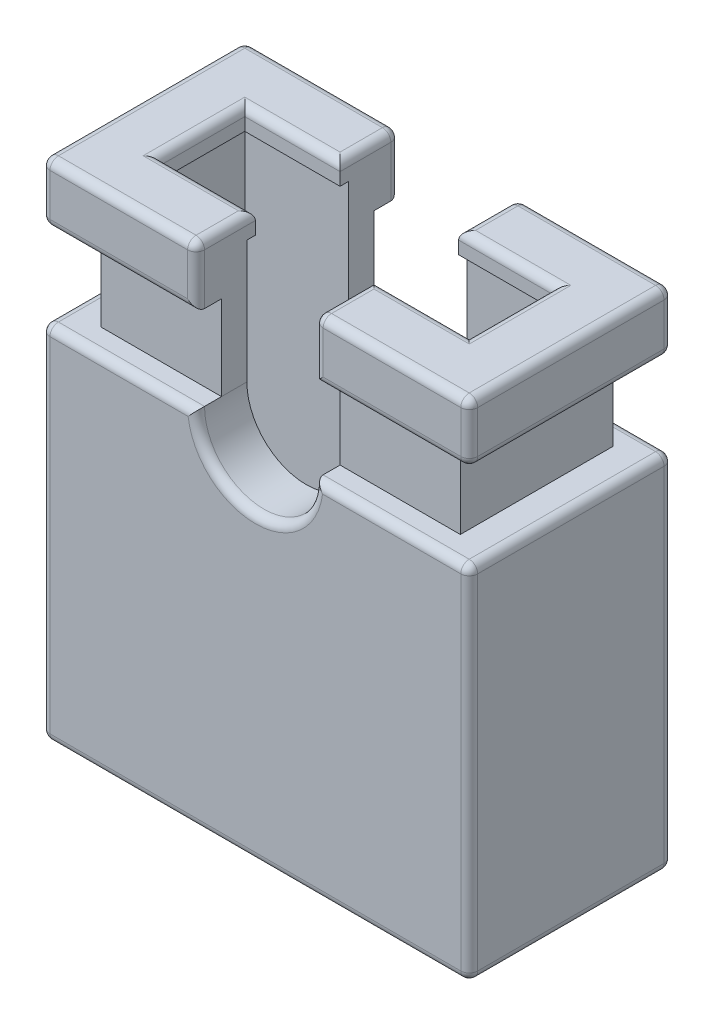
from build123d import *

# Parameters (mm, degrees)
SKETCH1_W          = 5.05
SKETCH1_H          = 5.96
MAIN_BODY_DEPTH    = 1.2
SKETCH2_W          = 5.05
SKETCH2_H          = 2.4
SKETCH2_W_2        = 4.24
SKETCH2_H_2        = 1.8
CUT_EXTRUDE1_DEPTH = 1
CUT_EXTRUDE2_START = -2.4
CUT_EXTRUDE2_DEPTH = 2.4
SKETCH4_W          = 3.85
SKETCH4_H          = 1.2
CUT_EXTRUDE3_DEPTH = 5.71
CUT_EXTRUDE4_START = -0.25
SKETCH5_W          = 3.65
SKETCH5_H          = 1
CUT_EXTRUDE4_DEPTH = 0.25
FILLET1_R          = 0.1
FILLET2_R          = 0.1


# Read off the part's stored shape, not the designer's step: Cut-Extrude2
with BuildPart() as part:
    # Sketch1 → Main Body (new, symmetric)
    with BuildSketch(Plane.XY):
        Rectangle(SKETCH1_W, SKETCH1_H)
    extrude(amount=MAIN_BODY_DEPTH, both=True)

    # Sketch2 → Cut-Extrude1 (cut)
    with BuildSketch(Plane(origin=(0, 2.28, 0), x_dir=(1, 0, 0), z_dir=(0, 1, 0))):
        Rectangle(SKETCH2_W, SKETCH2_H)
        Rectangle(SKETCH2_W_2, SKETCH2_H_2, mode=Mode.SUBTRACT)
    extrude(amount=-CUT_EXTRUDE1_DEPTH, mode=Mode.SUBTRACT)

    # Cut-Extrude2 outline → Cut-Extrude2 (cut)
    with BuildSketch(Plane.XY.offset(1.2).offset(CUT_EXTRUDE2_START)):
        with BuildLine():
            ThreePointArc((-0.7, 1.28), (0, 0.58), (0.7, 1.28))
            Line((0.7, 1.28), (0.7, 2.98))
            Line((0.7, 2.98), (-0.7, 2.98))
            Line((-0.7, 2.98), (-0.7, 1.28))
        make_face()
    extrude(amount=CUT_EXTRUDE2_DEPTH, mode=Mode.SUBTRACT)

    # Sketch4 → Cut-Extrude3 (cut)
    with BuildSketch(Plane.XZ.offset(2.98)):
        Rectangle(SKETCH4_W, SKETCH4_H)
    extrude(amount=-CUT_EXTRUDE3_DEPTH, mode=Mode.SUBTRACT)

    # Sketch5 → Cut-Extrude4 (cut)
    with BuildSketch(Plane(origin=(0, 2.98, 0), x_dir=(1, 0, 0), z_dir=(0, 1, 0)).offset(CUT_EXTRUDE4_START)):
        Rectangle(SKETCH5_W, SKETCH5_H)
    extrude(amount=CUT_EXTRUDE4_DEPTH, mode=Mode.SUBTRACT)

    # Fillet1
    fillet1_edges = [part.edges().sort_by_distance(p)[0] for p in [
        (-1.2625, 2.98, 0.5),
        (-0.7, 2.98, 0.85),
        (-1.6125, 2.98, 1.2),
        (-2.525, 2.98, 0),
        (-1.6125, 2.98, -1.2),
        (-0.7, 2.98, -0.85),
        (-1.2625, 2.98, -0.5),
        (-1.825, 2.98, 0),
        (1.2625, 2.98, -0.5),
        (0.7, 2.98, -0.85),
        (1.6125, 2.98, -1.2),
        (2.525, 2.98, 0),
        (1.6125, 2.98, 1.2),
        (0.7, 2.98, 0.85),
        (1.2625, 2.98, 0.5),
        (1.825, 2.98, 0),
        (2.525, -2.98, 0),
        (2.525, 1.28, 0),
        (-1.6125, 1.28, -1.2),
        (0, -2.98, -1.2),
        (2.525, -0.85, -1.2),
        (1.6125, 1.28, -1.2),
        (0, 0.58, -1.2),
        (1.6125, 1.28, 1.2),
        (2.525, -0.85, 1.2),
        (0, -2.98, 1.2),
        (-1.6125, 1.28, 1.2),
        (0, 0.58, 1.2),
        (-2.525, -0.85, 1.2),
        (-2.525, -2.98, 0),
        (-2.525, -0.85, -1.2),
        (-2.525, 1.28, 0),
    ]]
    fillet(fillet1_edges, radius=FILLET1_R)

    # Fillet2
    # the kernel refuses this fillet: 0.1 mm, written as the material it takes off along each edge
    with BuildSketch(Plane(origin=(-0.8, 2.88, -1.1), x_dir=(0, 0, -1), z_dir=(1, 0, 0))) as fillet2_piece_1_section:
        Polygon((0, 0), (FILLET2_R, 0), (FILLET2_R, FILLET2_R), (0, FILLET2_R), align=None)
    fillet2_piece_1 = extrude(amount=FILLET2_R, mode=Mode.PRIVATE)
    fillet2_piece_1 = fillet2_piece_1 - Plane(origin=(-0.8, 2.88, -1.1), x_dir=(0, -0.7071067811865475, 0.7071067811865475), z_dir=(1, 0, 0)) * Sphere(FILLET2_R, mode=Mode.PRIVATE)
    add(fillet2_piece_1, mode=Mode.SUBTRACT)
    with BuildSketch(Plane(origin=(-2.425, 2.88, -1.1), x_dir=(0, 0, -1), z_dir=(-1, 0, 0))) as fillet2_piece_2_section:
        Polygon((0, 0), (FILLET2_R, 0), (FILLET2_R, -FILLET2_R), (0, -FILLET2_R), align=None)
    fillet2_piece_2 = extrude(amount=FILLET2_R, mode=Mode.PRIVATE)
    fillet2_piece_2 = fillet2_piece_2 - Plane(origin=(-2.425, 2.88, -1.1), x_dir=(0, -0.7071067811865475, 0.7071067811865475), z_dir=(-1, 0, 0)) * Sphere(FILLET2_R, mode=Mode.PRIVATE)
    add(fillet2_piece_2, mode=Mode.SUBTRACT)
    with BuildSketch(Plane(origin=(-2.425, 2.88, 1.1), x_dir=(-1, 0, 0), z_dir=(0, 0, 1))) as fillet2_piece_3_section:
        Polygon((0, 0), (FILLET2_R, 0), (FILLET2_R, -FILLET2_R), (0, -FILLET2_R), align=None)
    fillet2_piece_3 = extrude(amount=FILLET2_R, mode=Mode.PRIVATE)
    fillet2_piece_3 = fillet2_piece_3 - Plane(origin=(-2.425, 2.88, 1.1), x_dir=(0.7071067811865476, -0.7071067811865475, 0), z_dir=(0, 0, 1)) * Sphere(FILLET2_R, mode=Mode.PRIVATE)
    add(fillet2_piece_3, mode=Mode.SUBTRACT)
    with BuildSketch(Plane(origin=(-0.8, 2.88, 1.1), x_dir=(0, 0, 1), z_dir=(1, 0, 0))) as fillet2_piece_4_section:
        Polygon((0, 0), (FILLET2_R, 0), (FILLET2_R, -FILLET2_R), (0, -FILLET2_R), align=None)
    fillet2_piece_4 = extrude(amount=FILLET2_R, mode=Mode.PRIVATE)
    fillet2_piece_4 = fillet2_piece_4 - Plane(origin=(-0.8, 2.88, 1.1), x_dir=(0, -0.7071067811865475, -0.7071067811865475), z_dir=(1, 0, 0)) * Sphere(FILLET2_R, mode=Mode.PRIVATE)
    add(fillet2_piece_4, mode=Mode.SUBTRACT)
    with BuildSketch(Plane(origin=(0.8, 2.88, 1.1), x_dir=(0, 0, 1), z_dir=(-1, 0, 0))) as fillet2_piece_5_section:
        Polygon((0, 0), (FILLET2_R, 0), (FILLET2_R, FILLET2_R), (0, FILLET2_R), align=None)
    fillet2_piece_5 = extrude(amount=FILLET2_R, mode=Mode.PRIVATE)
    fillet2_piece_5 = fillet2_piece_5 - Plane(origin=(0.8, 2.88, 1.1), x_dir=(0, -0.7071067811865475, -0.7071067811865475), z_dir=(-1, 0, 0)) * Sphere(FILLET2_R, mode=Mode.PRIVATE)
    add(fillet2_piece_5, mode=Mode.SUBTRACT)
    with BuildSketch(Plane(origin=(2.425, 2.88, 1.1), x_dir=(1, 0, 0), z_dir=(0, 0, 1))) as fillet2_piece_6_section:
        Polygon((0, 0), (FILLET2_R, 0), (FILLET2_R, FILLET2_R), (0, FILLET2_R), align=None)
    fillet2_piece_6 = extrude(amount=FILLET2_R, mode=Mode.PRIVATE)
    fillet2_piece_6 = fillet2_piece_6 - Plane(origin=(2.425, 2.88, 1.1), x_dir=(-0.7071067811865475, -0.7071067811865477, 0), z_dir=(0, 0, 1)) * Sphere(FILLET2_R, mode=Mode.PRIVATE)
    add(fillet2_piece_6, mode=Mode.SUBTRACT)
    with BuildSketch(Plane(origin=(2.425, 2.88, -1.1), x_dir=(1, 0, 0), z_dir=(0, 0, -1))) as fillet2_piece_7_section:
        Polygon((0, 0), (FILLET2_R, 0), (FILLET2_R, -FILLET2_R), (0, -FILLET2_R), align=None)
    fillet2_piece_7 = extrude(amount=FILLET2_R, mode=Mode.PRIVATE)
    fillet2_piece_7 = fillet2_piece_7 - Plane(origin=(2.425, 2.88, -1.1), x_dir=(-0.7071067811865475, -0.7071067811865477, 0), z_dir=(0, 0, -1)) * Sphere(FILLET2_R, mode=Mode.PRIVATE)
    add(fillet2_piece_7, mode=Mode.SUBTRACT)
    with BuildSketch(Plane(origin=(0.8, 2.88, -1.1), x_dir=(0, 0, -1), z_dir=(-1, 0, 0))) as fillet2_piece_8_section:
        Polygon((0, 0), (FILLET2_R, 0), (FILLET2_R, -FILLET2_R), (0, -FILLET2_R), align=None)
    fillet2_piece_8 = extrude(amount=FILLET2_R, mode=Mode.PRIVATE)
    fillet2_piece_8 = fillet2_piece_8 - Plane(origin=(0.8, 2.88, -1.1), x_dir=(0, -0.7071067811865475, 0.7071067811865475), z_dir=(-1, 0, 0)) * Sphere(FILLET2_R, mode=Mode.PRIVATE)
    add(fillet2_piece_8, mode=Mode.SUBTRACT)
    with BuildSketch(Plane(origin=(-2.425, 2.38, 1.1), x_dir=(0, 0, 1), z_dir=(0, -1, 0))) as fillet2_piece_9_section:
        Polygon((0, 0), (FILLET2_R, 0), (FILLET2_R, FILLET2_R), (0, FILLET2_R), align=None)
    fillet2_piece_9 = extrude(amount=FILLET2_R, mode=Mode.PRIVATE)
    fillet2_piece_9 = fillet2_piece_9 - Plane(origin=(-2.425, 2.38, 1.1), x_dir=(0.7071067811865475, 0, -0.7071067811865475), z_dir=(0, -1, 0)) * Sphere(FILLET2_R, mode=Mode.PRIVATE)
    add(fillet2_piece_9, mode=Mode.SUBTRACT)
    with BuildSketch(Plane(origin=(-2.425, 2.38, -1.1), x_dir=(0, -1, 0), z_dir=(0, 0, -1))) as fillet2_piece_10_section:
        Polygon((0, 0), (FILLET2_R, 0), (FILLET2_R, FILLET2_R), (0, FILLET2_R), align=None)
    fillet2_piece_10 = extrude(amount=FILLET2_R, mode=Mode.PRIVATE)
    fillet2_piece_10 = fillet2_piece_10 - Plane(origin=(-2.425, 2.38, -1.1), x_dir=(0.7071067811865475, 0.7071067811865477, 0), z_dir=(0, 0, -1)) * Sphere(FILLET2_R, mode=Mode.PRIVATE)
    add(fillet2_piece_10, mode=Mode.SUBTRACT)
    with BuildSketch(Plane(origin=(2.425, 2.38, -1.1), x_dir=(0, -1, 0), z_dir=(0, 0, -1))) as fillet2_piece_11_section:
        Polygon((0, 0), (FILLET2_R, 0), (FILLET2_R, -FILLET2_R), (0, -FILLET2_R), align=None)
    fillet2_piece_11 = extrude(amount=FILLET2_R, mode=Mode.PRIVATE)
    fillet2_piece_11 = fillet2_piece_11 - Plane(origin=(2.425, 2.38, -1.1), x_dir=(-0.7071067811865476, 0.7071067811865475, 0), z_dir=(0, 0, -1)) * Sphere(FILLET2_R, mode=Mode.PRIVATE)
    add(fillet2_piece_11, mode=Mode.SUBTRACT)
    with BuildSketch(Plane(origin=(2.425, 2.38, 1.1), x_dir=(0, -1, 0), z_dir=(0, 0, 1))) as fillet2_piece_12_section:
        Polygon((0, 0), (FILLET2_R, 0), (FILLET2_R, FILLET2_R), (0, FILLET2_R), align=None)
    fillet2_piece_12 = extrude(amount=FILLET2_R, mode=Mode.PRIVATE)
    fillet2_piece_12 = fillet2_piece_12 - Plane(origin=(2.425, 2.38, 1.1), x_dir=(-0.7071067811865476, 0.7071067811865475, 0), z_dir=(0, 0, 1)) * Sphere(FILLET2_R, mode=Mode.PRIVATE)
    add(fillet2_piece_12, mode=Mode.SUBTRACT)
    with BuildSketch(Plane(origin=(-0.7, 2.88, 1.2), x_dir=(0, 0, -1), z_dir=(0, -1, 0)), Plane(origin=(0.7, 2.03, 1.2), x_dir=(0, 0, -1), z_dir=(0, 1, 0))) as fillet2_piece_13:
        with BuildLine():
            CenterArc((FILLET2_R, -FILLET2_R), FILLET2_R, 90, 90)
            Line((0, -FILLET2_R), (0, 0))
            Line((0, 0), (FILLET2_R, 0))
        make_face()
    extrude(amount=0.85, mode=Mode.SUBTRACT)
    with BuildSketch(Plane(origin=(-2.525, 2.38, 1.2), x_dir=(1, 0, 0), z_dir=(0, 1, 0)), Plane(origin=(-2.525, 2.38, -1.2), x_dir=(0, 0, 1), z_dir=(0, 1, 0)), Plane(origin=(2.525, 2.88, 1.2), x_dir=(-1, 0, 0), z_dir=(0, -1, 0))) as fillet2_piece_14:
        with BuildLine():
            CenterArc((FILLET2_R, FILLET2_R), FILLET2_R, 180, 90)
            Line((0, FILLET2_R), (0, 0))
            Line((0, 0), (FILLET2_R, 0))
        make_face()
    extrude(amount=0.5, mode=Mode.SUBTRACT)
    with BuildSketch(Plane(origin=(2.525, 2.88, -1.2), x_dir=(-1, 0, 0), z_dir=(0, -1, 0))) as fillet2_piece_15:
        with BuildLine():
            CenterArc((FILLET2_R, -FILLET2_R), FILLET2_R, 90, 90)
            Line((0, -FILLET2_R), (0, 0))
            Line((0, 0), (FILLET2_R, 0))
        make_face()
    extrude(amount=0.5, mode=Mode.SUBTRACT)
    with BuildSketch(Plane(origin=(0.7, 2.03, -1.2), x_dir=(0, 0, 1), z_dir=(0, 1, 0)), Plane(origin=(-0.7, 2.88, -1.2), x_dir=(0, 0, 1), z_dir=(0, -1, 0))) as fillet2_piece_16:
        with BuildLine():
            CenterArc((FILLET2_R, FILLET2_R), FILLET2_R, 180, 90)
            Line((0, FILLET2_R), (0, 0))
            Line((0, 0), (FILLET2_R, 0))
        make_face()
    extrude(amount=0.85, mode=Mode.SUBTRACT)
    with BuildSketch(Plane(origin=(2.525, 2.28, 1.1), x_dir=(-1, 0, 0), z_dir=(0, 0, -1))) as fillet2_piece_17:
        with BuildLine():
            CenterArc((FILLET2_R, FILLET2_R), FILLET2_R, 180, 90)
            Line((0, FILLET2_R), (0, 0))
            Line((0, 0), (FILLET2_R, 0))
        make_face()
    extrude(amount=2.2, mode=Mode.SUBTRACT)
    with BuildSketch(Plane(origin=(2.425, 2.28, -1.2), x_dir=(0, 0, 1), z_dir=(-1, 0, 0))) as fillet2_piece_18:
        with BuildLine():
            CenterArc((FILLET2_R, FILLET2_R), FILLET2_R, 180, 90)
            Line((0, FILLET2_R), (0, 0))
            Line((0, 0), (FILLET2_R, 0))
        make_face()
    extrude(amount=1.975, mode=Mode.SUBTRACT)
    with BuildSketch(Plane(origin=(-2.525, 2.28, -1.1), x_dir=(0, 1, 0), z_dir=(0, 0, 1))) as fillet2_piece_19:
        with BuildLine():
            CenterArc((FILLET2_R, -FILLET2_R), FILLET2_R, 90, 90)
            Line((0, -FILLET2_R), (0, 0))
            Line((0, 0), (FILLET2_R, 0))
        make_face()
    extrude(amount=2.2, mode=Mode.SUBTRACT)
    with BuildSketch(Plane(origin=(-2.425, 2.28, 1.2), x_dir=(0, 1, 0), z_dir=(1, 0, 0)), Plane(origin=(-0.45, 2.28, -1.2), x_dir=(0, 1, 0), z_dir=(-1, 0, 0)), Plane(origin=(0.45, 2.28, 1.2), x_dir=(0, 1, 0), z_dir=(1, 0, 0))) as fillet2_piece_20:
        with BuildLine():
            CenterArc((FILLET2_R, -FILLET2_R), FILLET2_R, 90, 90)
            Line((0, -FILLET2_R), (0, 0))
            Line((0, 0), (FILLET2_R, 0))
        make_face()
    extrude(amount=1.975, mode=Mode.SUBTRACT)


solid = part.part
